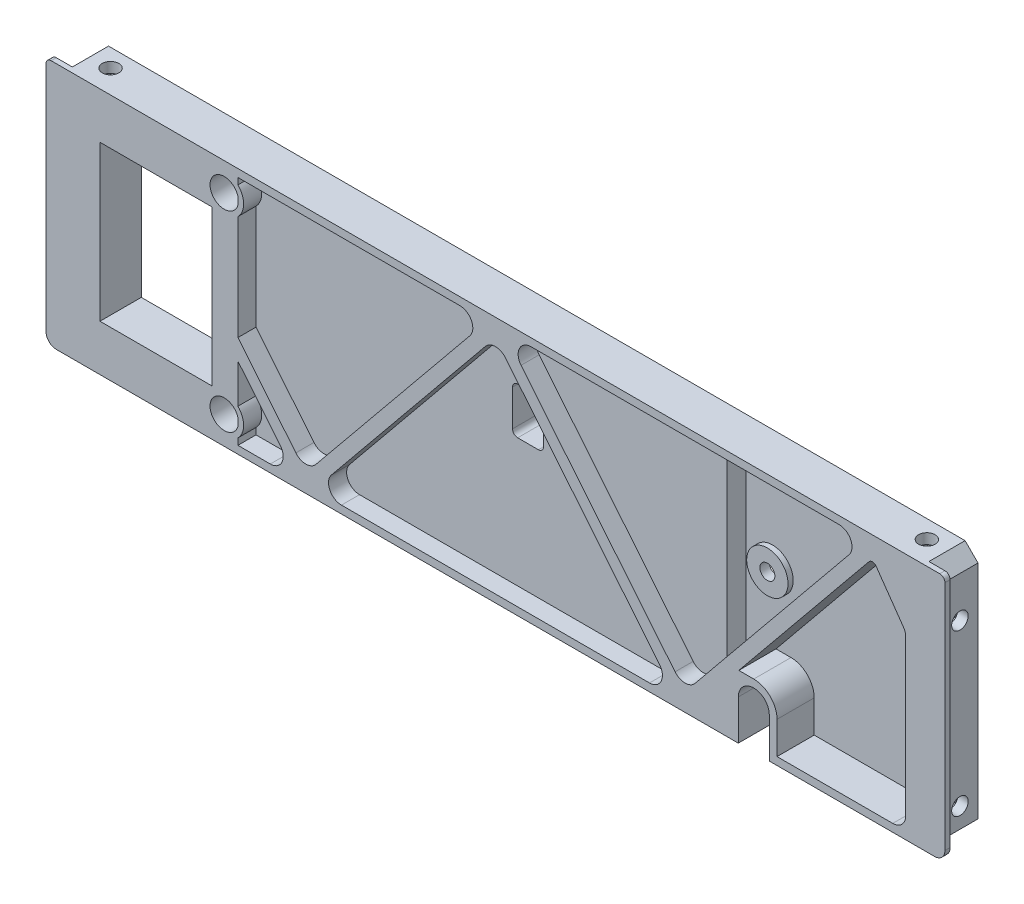
from build123d import *

# Parameters (mm, degrees)
SKETCH1_W                 = 174
SKETCH1_H                 = 51.1
BOSS_EXTRUDE1_DEPTH       = 8
SKETCH2_OUTSIDE_W         = 212.304
SKETCH2_OUTSIDE_H         = 89.404
SKETCH2_OUTSIDE_W_2       = 170.8
SKETCH2_OUTSIDE_H_2       = 47.9
CUT_EXTRUDE1_DEPTH        = 7
CHAMFER1_SIZE             = 2.5
FILLET1_R                 = 0.5
SKETCH3_W                 = 158.8
SKETCH3_H                 = 44.9
CUT_EXTRUDE2_DEPTH        = 7.2
BOSS_EXTRUDE2_DEPTH       = 7.2
F_3_0MM_DOWEL_HOLE1_D     = 3.2
F_3_0MM_DOWEL_HOLE1_DEPTH = 5
F_3_0MM_DOWEL_HOLE2_D     = 3.2
F_3_0MM_DOWEL_HOLE2_DEPTH = 5
CUT_EXTRUDE3_START        = -2
SKETCH10_W                = 6.25
SKETCH10_H                = 5.5
CUT_EXTRUDE3_DEPTH        = 1.8
CUT_EXTRUDE4_START        = -2
SKETCH11_W                = 5.5
SKETCH11_H                = 6.25
CUT_EXTRUDE4_DEPTH        = 1.8
BOSS_EXTRUDE3_DEPTH       = 7.2
SMALL_FIX_DEPTH           = 7.2
SKETCH14_W                = 174
SKETCH14_H                = 1.6
CUT_EXTRUDE5_DEPTH        = 91.94395252
FILLET2_R                 = 2.5
FILLET3_R                 = 1
FILLET4_R                 = 2
SKETCH23_W                = 174
SKETCH23_H                = 1.6
CUT_EXTRUDE9_DEPTH        = 91.94395252
BOSS_EXTRUDE7_START       = -7.2
BOSS_EXTRUDE7_DEPTH       = 7.2
SKETCH26_W                = 21.7
SKETCH26_H                = 30
CUT_EXTRUDE10_DEPTH       = 8
FILLET5_R                 = 1
SKETCH28_W                = 91.13
SKETCH28_H                = 44.9
BOSS_EXTRUDE8_DEPTH       = 3.7
SKETCH29_W                = 33
SKETCH29_H                = 18.02
SKETCH29_W_2              = 45.3
SKETCH29_H_2              = 20.8
SKETCH29_W_3              = 27.43
SKETCH29_H_3              = 20.3
SKETCH29_W_4              = 43.4
SKETCH29_H_4              = 17.6
CUT_EXTRUDE11_DEPTH       = 1.6
SKETCH30_W                = 14
SKETCH30_H                = 10.4
SKETCH30_W_2              = 6.8
SKETCH30_H_2              = 20.8
SKETCH30_W_3              = 28.4
SKETCH30_H_3              = 17.6
SKETCH30_W_4              = 7
SKETCH30_W_5              = 4
SKETCH30_H_4              = 20.3
SKETCH30_W_6              = 6.5
CUT_EXTRUDE12_DEPTH       = 2.4
CUT_EXTRUDE13_DEPTH       = 91.348505798
CUT_EXTRUDE13_DEPTH_BACK  = 91.348505798
SKETCH31_R                = 1.45
SKETCH32_R                = 2.75
CUT_EXTRUDE14_DEPTH       = 6
BOSS_EXTRUDE9_START       = 1
SKETCH33_R                = 4
SKETCH33_R_2              = 1.45
BOSS_EXTRUDE9_DEPTH       = 1
BOSS_EXTRUDE10_DEPTH      = 3.5
CUT_EXTRUDE15_DEPTH       = 91.52316002
CUT_EXTRUDE15_DEPTH_BACK  = 91.52316002
BOSS_EXTRUDE12_DEPTH      = 7.2
CUT_EXTRUDE16_DEPTH       = 91.590300253
SKETCH40_W                = 1.2
SKETCH40_H                = 20.8
BOSS_EXTRUDE13_DEPTH      = 0.6


with BuildPart() as part:
    # Sketch1 → Boss-Extrude1 (new body)
    with BuildSketch(Plane.XY):
        Rectangle(SKETCH1_W, SKETCH1_H)
    extrude(amount=-BOSS_EXTRUDE1_DEPTH)

    # Sketch2 outside → Cut-Extrude1 (cut)
    with BuildSketch(Plane(origin=(0, 0, -8), x_dir=(-1, 0, 0), z_dir=(0, 0, -1))):
        Rectangle(SKETCH2_OUTSIDE_W, SKETCH2_OUTSIDE_H)
        Rectangle(SKETCH2_OUTSIDE_W_2, SKETCH2_OUTSIDE_H_2, mode=Mode.SUBTRACT)
    extrude(amount=-CUT_EXTRUDE1_DEPTH, mode=Mode.SUBTRACT)

    # Chamfer1
    chamfer1_edges = [part.edges().sort_by_distance(p)[0] for p in [
        (85.4, -23.95, -4.5),
        (85.4, 23.95, -4.5),
        (-85.4, 23.95, -4.5),
        (-85.4, -23.95, -4.5),
    ]]
    chamfer(chamfer1_edges, length=CHAMFER1_SIZE)

    # Fillet1
    fillet1_edges = [part.edges().sort_by_distance(p)[0] for p in [
        (87, 25.55, -0.5),
        (-87, 25.55, -0.5),
    ]]
    fillet(fillet1_edges, radius=FILLET1_R)

    # Sketch3 → Cut-Extrude2 (cut)
    with BuildSketch(Plane.XY):
        Rectangle(SKETCH3_W, SKETCH3_H)
    extrude(amount=-CUT_EXTRUDE2_DEPTH, mode=Mode.SUBTRACT)

    # Sketch9 → Boss-Extrude2 (add)
    with BuildSketch(Plane.XY):
        Polygon((-73.4, 22.45), (-73.4, 19.45), (-79.4, 10.88111196), (-79.4, 22.45), align=None)
    boss_extrude2 = extrude(amount=-BOSS_EXTRUDE2_DEPTH)

    # Ø3.0mm Dowel Hole1
    with Locations(Plane.ZY.offset(85.4)):
        with Locations((-4.5, 13.55), (-4.5, -17.55)):
            f_3_0mm_dowel_hole1 = Hole(F_3_0MM_DOWEL_HOLE1_D / 2, depth=F_3_0MM_DOWEL_HOLE1_DEPTH)

    # Ø3.0mm Dowel Hole2
    with Locations(Plane(origin=(0, 23.95, 0), x_dir=(1, 0, 0), z_dir=(0, 1, 0))):
        with Locations((-79, 4.5)):
            f_3_0mm_dowel_hole2 = Hole(F_3_0MM_DOWEL_HOLE2_D / 2, depth=F_3_0MM_DOWEL_HOLE2_DEPTH)

    # Sketch10 → Cut-Extrude3 (cut)
    with BuildSketch(Plane.ZY.offset(85.4).offset(CUT_EXTRUDE3_START)):
        with Locations((-4.875, 13.55)):
            Rectangle(SKETCH10_W, SKETCH10_H)
        with Locations((-4.875, -17.55)):
            Rectangle(SKETCH10_W, SKETCH10_H)
    cut_extrude3 = extrude(amount=-CUT_EXTRUDE3_DEPTH, mode=Mode.SUBTRACT)

    # Sketch11 → Cut-Extrude4 (cut)
    with BuildSketch(Plane(origin=(0, 23.95, 0), x_dir=(1, 0, 0), z_dir=(0, 1, 0)).offset(CUT_EXTRUDE4_START)):
        with Locations((-79, 4.875)):
            Rectangle(SKETCH11_W, SKETCH11_H)
    cut_extrude4 = extrude(amount=-CUT_EXTRUDE4_DEPTH, mode=Mode.SUBTRACT)

    # Mirror1: Boss-Extrude2, Ø3.0mm Dowel Hole1, Ø3.0mm Dowel Hole2, Cut-Extrude3, Cut-Extrude4 across plane
    add(boss_extrude2.mirror(Plane(origin=(0, 0, 0), x_dir=(0, 0, 1), z_dir=(1, 0, 0))))
    add(f_3_0mm_dowel_hole1.mirror(Plane(origin=(0, 0, 0), x_dir=(0, 0, 1), z_dir=(1, 0, 0))), mode=Mode.SUBTRACT)
    add(f_3_0mm_dowel_hole2.mirror(Plane(origin=(0, 0, 0), x_dir=(0, 0, 1), z_dir=(1, 0, 0))), mode=Mode.SUBTRACT)
    add(cut_extrude3.mirror(Plane(origin=(0, 0, 0), x_dir=(0, 0, 1), z_dir=(1, 0, 0))), mode=Mode.SUBTRACT)
    add(cut_extrude4.mirror(Plane(origin=(0, 0, 0), x_dir=(0, 0, 1), z_dir=(1, 0, 0))), mode=Mode.SUBTRACT)

    # Sketch12 → Boss-Extrude3 (add)
    with BuildSketch(Plane.XY.offset(-7.2)):
        with BuildLine():
            Line((-74.367830663, 21.658922376), (-37.47426453, -23.477892866))
            ThreePointArc((-37.47426453, -23.477892866), (-36.7, -23.845030766), (-35.92573547, -23.477892866))
            Line((-35.92573547, -23.477892866), (0, 20.474846169))
            Line((0, 20.474846169), (35.92573547, -23.477892866))
            ThreePointArc((35.92573547, -23.477892866), (36.7, -23.845030766), (37.47426453, -23.477892866))
            Line((37.47426453, -23.477892866), (74.367830663, 21.658922376))
            ThreePointArc((74.367830663, 21.658922376), (74.191077624, 23.417830663), (72.432169337, 23.241077624))
            Line((72.432169337, 23.241077624), (36.7, -20.474846169))
            Line((36.7, -20.474846169), (0.77426453, 23.477892866))
            ThreePointArc((0.77426453, 23.477892866), (0, 23.845030766), (-0.77426453, 23.477892866))
            Line((-0.77426453, 23.477892866), (-36.7, -20.474846169))
            Line((-36.7, -20.474846169), (-72.432169337, 23.241077624))
            ThreePointArc((-72.432169337, 23.241077624), (-74.191077624, 23.417830663), (-74.367830663, 21.658922376))
        make_face()
    extrude(amount=BOSS_EXTRUDE3_DEPTH)

    # Sketch13 → Small Fix (add)
    with BuildSketch(Plane.XY):
        Polygon((-73.4, 19.45), (-73.4, 20.474846169), (-72.562319501, 19.45), align=None)
        Polygon((72.562319501, 19.45), (73.4, 19.45), (73.4, 20.474846169), align=None)
    extrude(amount=-SMALL_FIX_DEPTH)

    # Sketch14 → Cut-Extrude5 (cut, through all)
    with BuildSketch(Plane(origin=(0, 0, -1), x_dir=(-1, 0, 0), z_dir=(0, 0, -1))):
        with Locations((0, -24.75)):
            Rectangle(SKETCH14_W, SKETCH14_H)
    extrude(amount=-CUT_EXTRUDE5_DEPTH, mode=Mode.SUBTRACT)

    # Fillet2
    fillet2_edges = [part.edges().sort_by_distance(p)[0] for p in [
        (-79.4, 10.88111196, -3.6),
        (79.4, 10.88111196, -3.6),
        (35.085564686, -22.45, -3.6),
        (-35.085564686, -22.45, -3.6),
        (71.785564686, 22.45, -3.6),
        (1.614435314, 22.45, -3.6),
        (36.7, -20.474846169, -3.6),
        (-1.614435314, 22.45, -3.6),
        (-71.785564686, 22.45, -3.6),
        (-36.7, -20.474846169, -3.6),
        (0, 20.474846169, -3.6),
        (-38.314435314, -22.45, -3.6),
        (38.314435314, -22.45, -3.6),
        (-79.4, -22.45, -3.6),
        (79.4, -22.45, -3.6),
    ]]
    fillet(fillet2_edges, radius=FILLET2_R)

    # Fillet3
    # the kernel refuses this fillet: 1 mm, written as the material it adds along each edge
    with BuildSketch(Plane(origin=(73.4, 19.45, 0), x_dir=(-1, 0, 0), z_dir=(0, 0, -1))) as fillet3_piece_1_section:
        with BuildLine():
            CenterArc((FILLET3_R * 0.520567050552, -FILLET3_R), FILLET3_R, 90, 55)
            Line((-FILLET3_R * 0.298584993737, -FILLET3_R * 0.426423563649), (0, 0))
            Line((0, 0), (FILLET3_R * 0.520567050552, 0))
        make_face()
    fillet3_piece_1 = extrude(amount=8.501417626, mode=Mode.PRIVATE)
    fillet3_piece_1 = split(fillet3_piece_1, bisect_by=Plane(origin=(73.353785403, 19.361222585, -8), z_dir=(0, 0, 1)), keep=Keep.TOP, mode=Mode.PRIVATE)
    add(fillet3_piece_1)
    with BuildSketch(Plane(origin=(72.562319501, 19.45, 0), x_dir=(-0.6328620994689726, -0.7742645304130392, 0), z_dir=(0, 0, -1))) as fillet3_piece_2_section:
        with BuildLine():
            CenterArc((FILLET3_R * 0.474176313275, -FILLET3_R), FILLET3_R, 90, 50.738399871)
            Line((-FILLET3_R * 0.300088217138, -FILLET3_R * 0.367137900531), (0, 0))
            Line((0, 0), (FILLET3_R * 0.474176313275, 0))
        make_face()
    fillet3_piece_2 = extrude(amount=8.385440783, mode=Mode.PRIVATE)
    fillet3_piece_2 = split(fillet3_piece_2, bisect_by=Plane(origin=(72.598343981, 19.374027247, -8), z_dir=(0, 0, 1)), keep=Keep.TOP, mode=Mode.PRIVATE)
    add(fillet3_piece_2)
    with BuildSketch(Plane(origin=(-72.562319501, 19.45, 0), x_dir=(0.6328620994689873, -0.7742645304130272, 0), z_dir=(0, 0, -1))) as fillet3_piece_3:
        with BuildLine():
            CenterArc((FILLET3_R * 0.474176313275, FILLET3_R), FILLET3_R, 219.261600129, 50.738399871)
            Line((-FILLET3_R * 0.300088217138, FILLET3_R * 0.367137900531), (0, 0))
            Line((0, 0), (FILLET3_R * 0.474176313275, 0))
        make_face()
    extrude(amount=7.2)
    with BuildSketch(Plane(origin=(-73.4, 19.45, 0), x_dir=(1, 0, 0), z_dir=(0, 0, -1))) as fillet3_piece_4:
        with BuildLine():
            CenterArc((FILLET3_R * 0.520567050552, FILLET3_R), FILLET3_R, 215, 55)
            Line((-FILLET3_R * 0.298584993737, FILLET3_R * 0.426423563649), (0, 0))
            Line((0, 0), (FILLET3_R * 0.520567050552, 0))
        make_face()
    extrude(amount=7.2)

    # Fillet4
    fillet4_edges = [part.edges().sort_by_distance(p)[0] for p in [
        (87, -23.95, -0.5),
        (-87, -23.95, -0.5),
    ]]
    fillet(fillet4_edges, radius=FILLET4_R)

    # Sketch23 → Cut-Extrude9 (cut, through all)
    with BuildSketch(Plane(origin=(0, 0, -1), x_dir=(-1, 0, 0), z_dir=(0, 0, -1))):
        with Locations((0, 24.75)):
            Rectangle(SKETCH23_W, SKETCH23_H)
    extrude(amount=-CUT_EXTRUDE9_DEPTH, mode=Mode.SUBTRACT)

    # Sketch24 → Boss-Extrude7 (add)
    with BuildSketch(Plane.XY.offset(BOSS_EXTRUDE7_START)):
        with BuildLine():
            Line((-73.698584994, 19.023576436), (-73.698584994, 22.45))
            Line((-73.698584994, 22.45), (-49.85, 22.45))
            Line((-49.85, 22.45), (-49.85, -22.45))
            Line((-49.85, -22.45), (-79.4, -22.45))
            Line((-79.4, -22.45), (-79.4, 10.092864987))
            ThreePointArc((-79.4, 10.092864987), (-79.284292377, 10.844629486), (-78.947880111, 11.526806078))
            Line((-78.947880111, 11.526806078), (-73.698584994, 19.023576436))
        make_face()
    extrude(amount=BOSS_EXTRUDE7_DEPTH)

    # Sketch26 → Cut-Extrude10 (cut)
    with BuildSketch(Plane.XY):
        with Locations((-65.7, 0)):
            Rectangle(SKETCH26_W, SKETCH26_H)
    extrude(amount=-CUT_EXTRUDE10_DEPTH, mode=Mode.SUBTRACT)

    # Fillet5
    fillet5_edges = [part.edges().sort_by_distance(p)[0] for p in [
        (87, 23.95, -0.5),
        (-87, 23.95, -0.5),
    ]]
    fillet(fillet5_edges, radius=FILLET5_R)

    # Sketch28 → Boss-Extrude8 (add)
    with BuildSketch(Plane.XY.offset(-7.2)):
        with Locations((-4.285, 0)):
            Rectangle(SKETCH28_W, SKETCH28_H)
    extrude(amount=BOSS_EXTRUDE8_DEPTH)

    # Sketch29 → Cut-Extrude11 (cut)
    with BuildSketch(Plane(origin=(0, 0, -8), x_dir=(-1, 0, 0), z_dir=(0, 0, -1))):
        with Locations((-24.1, 13.09)):
            Rectangle(SKETCH29_W, SKETCH29_H)
        with Locations((-17.78, -11.7)):
            Rectangle(SKETCH29_W_2, SKETCH29_H_2)
        with Locations((32.285, -11.95)):
            Rectangle(SKETCH29_W_3, SKETCH29_H_3)
        with Locations((24.3, 13.3)):
            Rectangle(SKETCH29_W_4, SKETCH29_H_4)
    extrude(amount=-CUT_EXTRUDE11_DEPTH, mode=Mode.SUBTRACT)

    # Sketch30 → Cut-Extrude12 (cut)
    with BuildSketch(Plane(origin=(0, 0, -6.4), x_dir=(-1, 0, 0), z_dir=(0, 0, -1))):
        with Locations((-33.43, -6.5)):
            Rectangle(SKETCH30_W, SKETCH30_H)
        with Locations((0.27, -11.7)):
            Rectangle(SKETCH30_W_2, SKETCH30_H_2)
        with Locations((19.8, 13.3)):
            Rectangle(SKETCH30_W_3, SKETCH30_H_3)
        with Locations((42.5, 13.3)):
            Rectangle(SKETCH30_W_4, SKETCH30_H_3)
        with Locations((20.57, -11.95)):
            Rectangle(SKETCH30_W_5, SKETCH30_H_4)
        with Locations((42.75, -11.95)):
            Rectangle(SKETCH30_W_6, SKETCH30_H_4)
    extrude(amount=-CUT_EXTRUDE12_DEPTH, mode=Mode.SUBTRACT)

    # Sketch31 → Cut-Extrude13 (cut, two sides: drawn at the far end of the back side and taken through both)
    with BuildSketch(Plane.XY.offset(-3.5).offset(-CUT_EXTRUDE13_DEPTH_BACK)):
        with Locations((46.43, 1.39)):
            Circle(SKETCH31_R)
        with Locations((-52.5, -18.55)):
            Circle(SKETCH31_R)
        with Locations((-52.5, 18.55)):
            Circle(SKETCH31_R)
    extrude(amount=CUT_EXTRUDE13_DEPTH + CUT_EXTRUDE13_DEPTH_BACK, mode=Mode.SUBTRACT)

    # Sketch32 → Cut-Extrude14 (cut)
    with BuildSketch(Plane.XY):
        with Locations((-52.5, 18.55)):
            Circle(SKETCH32_R)
        with Locations((-52.5, -18.55)):
            Circle(SKETCH32_R)
    extrude(amount=-CUT_EXTRUDE14_DEPTH, mode=Mode.SUBTRACT)

    # Sketch33 → Boss-Extrude9 (add)
    with BuildSketch(Plane.XY.offset(-7.2).offset(BOSS_EXTRUDE9_START)):
        with Locations((46.43, 1.39)):
            Circle(SKETCH33_R)
        with Locations((46.43, 1.39)):
            Circle(SKETCH33_R_2, mode=Mode.SUBTRACT)
    extrude(amount=-BOSS_EXTRUDE9_DEPTH)

    # Sketch34 → Boss-Extrude10 (add)
    with BuildSketch(Plane.XY):
        with BuildLine():
            Line((-49.85, 21.203299832), (-49.85, 15.896700168))
            ThreePointArc((-49.85, 15.896700168), (-48.75, 18.55), (-49.85, 21.203299832))
        make_face()
        with BuildLine():
            Line((-49.85, -21.203299832), (-49.85, -15.896700168))
            ThreePointArc((-49.85, -15.896700168), (-48.75, -18.55), (-49.85, -21.203299832))
        make_face()
    extrude(amount=-BOSS_EXTRUDE10_DEPTH)

    # Sketch35 → Cut-Extrude15 (cut, two sides: drawn at the far end of the back side and taken through both)
    with BuildSketch(Plane.XY.offset(-7.2).offset(-CUT_EXTRUDE15_DEPTH_BACK)):
        with BuildLine():
            Line((47, -16.2), (47, -23.95))
            Line((47, -23.95), (53, -23.95))
            Line((53, -23.95), (53, -16.2))
            ThreePointArc((53, -16.2), (50, -13.2), (47, -16.2))
        make_face()
    extrude(amount=CUT_EXTRUDE15_DEPTH + CUT_EXTRUDE15_DEPTH_BACK, mode=Mode.SUBTRACT)

    # Sketch37 → Boss-Extrude12 (add)
    with BuildSketch(Plane.XY):
        with BuildLine():
            Line((47, -16.2), (47, -22.45))
            Line((47, -22.45), (43.586735785, -22.45))
            ThreePointArc((43.586735785, -22.45), (41.327821431, -21.021123681), (41.651074459, -18.367844751))
            Line((41.651074459, -18.367844751), (47.101183643, -11.7))
            Line((47.101183643, -11.7), (50, -11.7))
            ThreePointArc((50, -11.7), (53.181980515, -13.018019485), (54.5, -16.2))
            Line((54.5, -16.2), (54.5, -22.45))
            Line((54.5, -22.45), (53, -22.45))
            Line((53, -22.45), (53, -16.2))
            ThreePointArc((53, -16.2), (50, -13.2), (47, -16.2))
        make_face()
    extrude(amount=-BOSS_EXTRUDE12_DEPTH)

    # Sketch39 → Cut-Extrude16 (cut, through all)
    with BuildSketch(Plane(origin=(0, 0, -8), x_dir=(-1, 0, 0), z_dir=(0, 0, -1))):
        with BuildLine():
            Line((-0.8, 11.39), (-4.8, 11.39))
            ThreePointArc((-4.8, 11.39), (-5.507106781, 11.097106781), (-5.8, 10.39))
            Line((-5.8, 10.39), (-5.8, 3.39))
            ThreePointArc((-5.8, 3.39), (-5.507106781, 2.682893219), (-4.8, 2.39))
            Line((-4.8, 2.39), (-0.8, 2.39))
            ThreePointArc((-0.8, 2.39), (-0.092893219, 2.682893219), (0.2, 3.39))
            Line((0.2, 3.39), (0.2, 10.39))
            ThreePointArc((0.2, 10.39), (-0.092893219, 11.097106781), (-0.8, 11.39))
        make_face()
    extrude(amount=-CUT_EXTRUDE16_DEPTH, mode=Mode.SUBTRACT)

    # Sketch40 → Boss-Extrude13 (add)
    with BuildSketch(Plane(origin=(0, 0, -6.4), x_dir=(-1, 0, 0), z_dir=(0, 0, -1))):
        Polygon((-40.43, -11.7), (-40.43, -22.1), (-3.13, -22.1), (-3.13, -1.3), (-26.43, -1.3), (-26.43, -11.7), align=None)
        with Locations((4.27, -11.7)):
            Rectangle(SKETCH40_W, SKETCH40_H)
    extrude(amount=BOSS_EXTRUDE13_DEPTH)


solid = part.part
